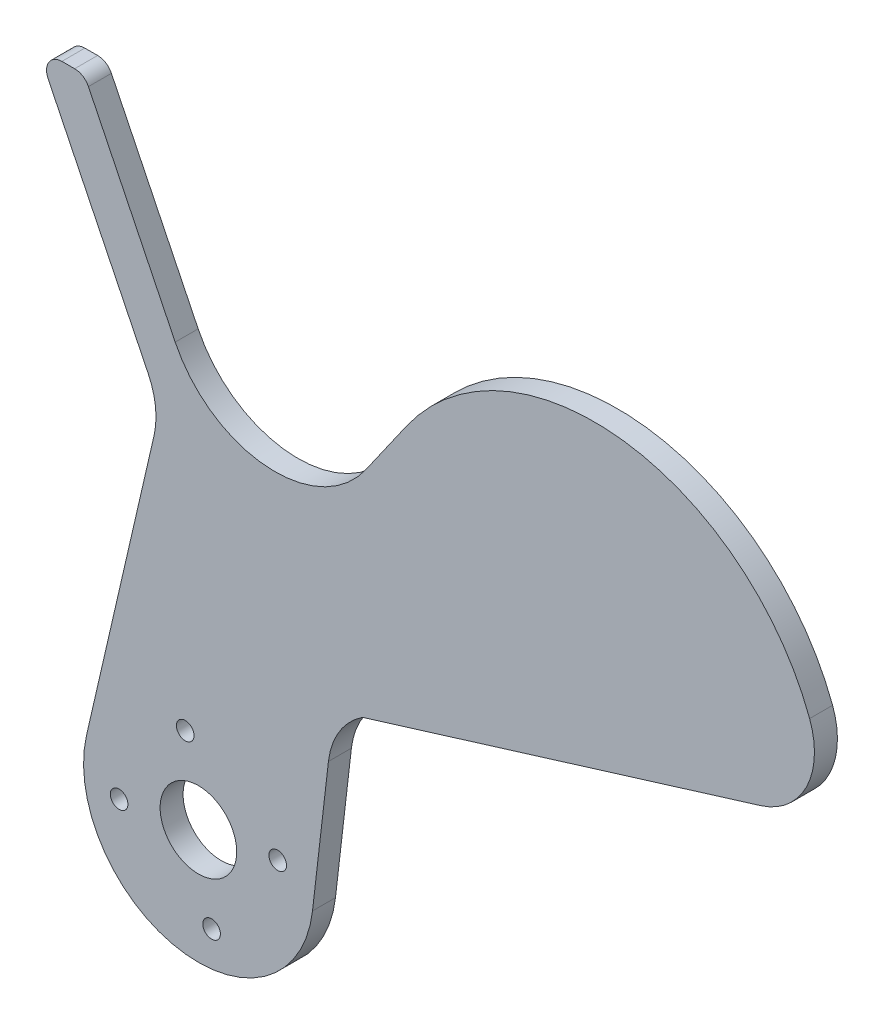
from build123d import *

# Parameters (mm, degrees)
BOSS_EXTRUDE1_START            = -3
BOSS_EXTRUDE1_OUTLINE_R        = 2.5
BOSS_EXTRUDE1_DEPTH            = 3
FILLET1_R                      = 10
BOSS_EXTRUDE2_START            = -3
BOSS_EXTRUDE2_DEPTH            = 3
CUT_EXTRUDE1_START             = -3
CUT_EXTRUDE1_DEPTH             = 3
FILLET2_R                      = 10
F_2_3_2_3_DIAMETER_HOLE1_D     = 2.3
F_2_3_2_3_DIAMETER_HOLE1_DEPTH = 10
F_2_3_2_3_DIAMETER_HOLE1_TIP   = 0.690989712
SKETCH6_R                      = 5
CUT_EXTRUDE2_DEPTH             = 103.947966144


with BuildPart() as part:
    # Boss-Extrude1: read off the stored shape, not the designer's step
    # Boss-Extrude1 outline → Boss-Extrude1 (new body)
    with BuildSketch(Plane.XY.offset(3).offset(BOSS_EXTRUDE1_START)):
        with BuildLine():
            ThreePointArc((-24.364065342, 16.876742294), (-25.101814907, 17.696096192), (-26.161653435, 18))
            Line((-26.161653435, 18), (-27.830556346, 18))
            ThreePointArc((-27.830556346, 18), (-29.526652538, 17.059838528), (-29.628144438, 15.123257706))
            Line((-29.628144438, 15.123257706), (-16.550964109, -11.68893536))
            ThreePointArc((-16.550964109, -11.68893536), (-15.603505287, -14.937815984), (-15.793938159, -18.316667689))
            Line((-15.793938159, -18.316667689), (-24.617449619, -56.633968709))
            ThreePointArc((-24.617449619, -56.633968709), (-12.550978841, -74.781492041), (4.900124379, -61.728089553))
            Line((4.900124379, -61.728089553), (7.520756747, -39.132184047))
            Line((7.520756747, -39.132184047), (57.484416951, -6.361887987))
            ThreePointArc((57.484416951, -6.361887987), (61.581724267, 4.861915454), (52, 12))
            Line((52, 12), (41.720733512, 12))
            ThreePointArc((41.720733512, 12), (27.868275115, 8.610324995), (17.146172183, -0.792706909))
            Line((17.146172183, -0.792706909), (11.877704642, -8.316858327))
            ThreePointArc((11.877704642, -8.316858327), (-1.137656888, -14.455301339), (-13.032513671, -6.356381628))
            Line((-13.032513671, -6.356381628), (-24.364065342, 16.876742294))
        make_face()
        with Locations((-10, -60)):
            Circle(BOSS_EXTRUDE1_OUTLINE_R, mode=Mode.SUBTRACT)
    extrude(amount=BOSS_EXTRUDE1_DEPTH)

    # Fillet1
    fillet1_edges = [part.edges().sort_by_distance(p)[0] for p in [
        (7.520756747, -39.132184047, 1.5),
    ]]
    fillet(fillet1_edges, radius=FILLET1_R)

    # Sketch2 → Boss-Extrude2 (add)
    with BuildSketch(Plane.XY.offset(3).offset(BOSS_EXTRUDE2_START)):
        with BuildLine():
            Line((11.431019345, -36.567510792), (71.720733512, -18))
            ThreePointArc((71.720733512, -18), (69.105682696, -5.749915992), (61.716429632, 4.364528537))
            ThreePointArc((61.716429632, 4.364528537), (61.302173782, -1.670090316), (57.484416951, -6.361887987))
            Line((57.484416951, -6.361887987), (11.431019345, -36.567510792))
        make_face()
    extrude(amount=BOSS_EXTRUDE2_DEPTH)

    # Sketch2<4> → Cut-Extrude1 (cut)
    with BuildSketch(Plane.XY.offset(3).offset(CUT_EXTRUDE1_START)):
        with BuildLine():
            ThreePointArc((41.720733512, 12), (52.42269931, 10.026200742), (61.716429632, 4.364528537))
            ThreePointArc((61.716429632, 4.364528537), (58.178782835, 9.862737607), (52, 12))
            Line((52, 12), (41.720733512, 12))
        make_face()
    extrude(amount=CUT_EXTRUDE1_DEPTH, mode=Mode.SUBTRACT)

    # Fillet2
    fillet2_edges = [part.edges().sort_by_distance(p)[0] for p in [
        (71.720733512, -18, 1.5),
    ]]
    fillet(fillet2_edges, radius=FILLET2_R)

    # Ø2.3 (2.3) Diameter Hole1
    with Locations(Plane.XY.offset(3)):
        with Locations((-20.357910666, -61.721536128), (-11.721536128, -49.642089334), (-8.278463872, -70.357910666), (0.357910666, -58.278463872)):
            Hole(F_2_3_2_3_DIAMETER_HOLE1_D / 2, depth=F_2_3_2_3_DIAMETER_HOLE1_DEPTH)
            with Locations((0, 0, -(F_2_3_2_3_DIAMETER_HOLE1_DEPTH + F_2_3_2_3_DIAMETER_HOLE1_TIP / 2))):  # 118° drill point
                Cone(0, F_2_3_2_3_DIAMETER_HOLE1_D / 2, F_2_3_2_3_DIAMETER_HOLE1_TIP, mode=Mode.SUBTRACT)

    # Sketch6 → Cut-Extrude2 (cut, through all)
    with BuildSketch(Plane.XY.offset(3)):
        with Locations((-10, -60)):
            Circle(SKETCH6_R)
    extrude(amount=-CUT_EXTRUDE2_DEPTH, mode=Mode.SUBTRACT)


solid = part.part
